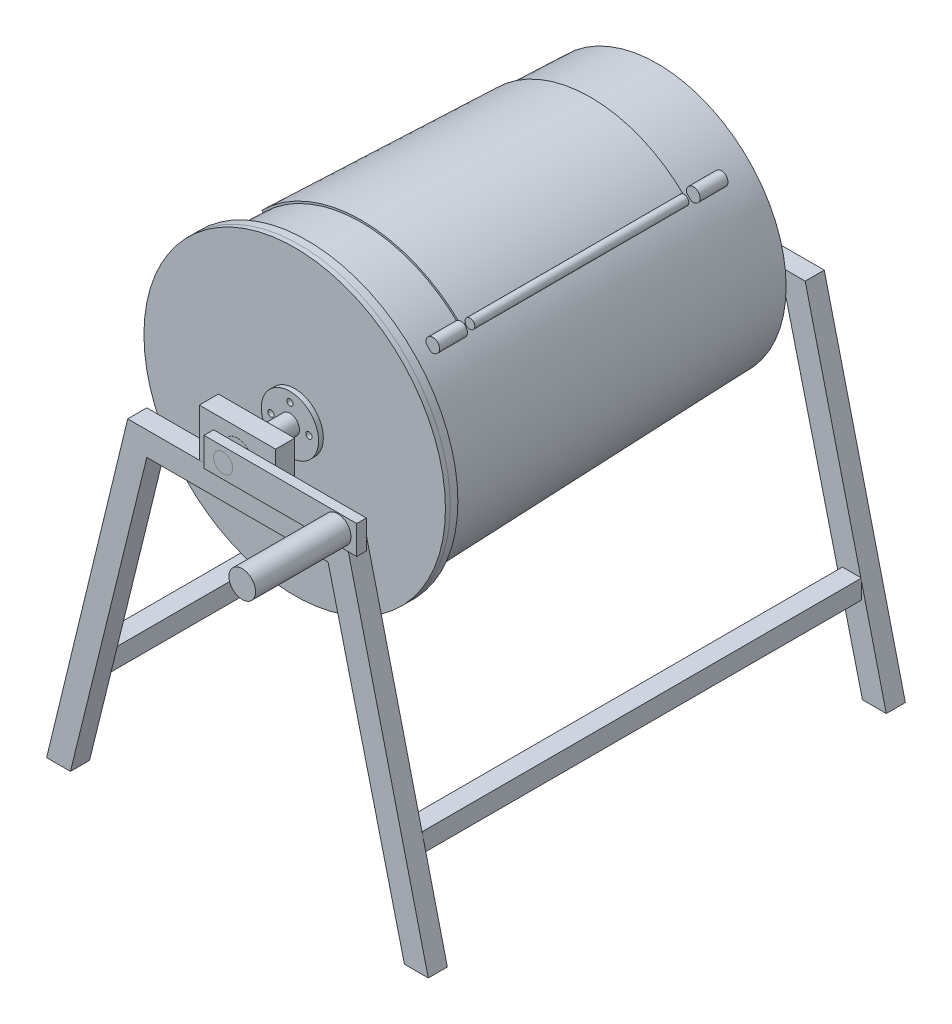
from build123d import *

# Parameters (mm, degrees)
RIGHT_SUPPORT_BLANK_START         = 230
RIGHT_SUPPORT_BLANK_DEPTH         = 20
HOLLOW_SUPPORT_2MM_T              = -2
F_20L_TAPERED_PAIL_BLANK_START    = -190
PAIL_BASE_PROFILE_R               = 135
F_20L_TAPERED_PAIL_BLANK_DEPTH    = 375
F_20L_TAPERED_PAIL_BLANK_DRAFT    = -1.99
F_20L_PAIL_PLASTIC_WALL_T         = -2
PAIL_REINFORCED_RIM_START         = 177
PAIL_RIM_PROFILE_R                = 158
PAIL_RIM_PROFILE_R_2              = 146
PAIL_REINFORCED_RIM_DEPTH         = 8
F_20L_PAIL_REMOVABLE_LID_START    = 185
ROUND_LID_PROFILE_R               = 158
F_20L_PAIL_REMOVABLE_LID_DEPTH    = 5
FRONT_BEARING_BLOCK_START         = 230
BEARING_BLOCK_PROFILE_W           = 80
BEARING_BLOCK_PROFILE_H           = 50
BEARING_BLOCK_PROFILE_R           = 15.1
FRONT_BEARING_BLOCK_DEPTH         = 20
FRONT_PLAIN_BUSH_START            = 230
PLAIN_BUSH_PROFILE_R              = 15
PLAIN_BUSH_PROFILE_R_2            = 10.2
FRONT_PLAIN_BUSH_DEPTH            = 20
LONGITUDINAL_BRACES_PROFILE_W     = 20
LONGITUDINAL_BRACES_PROFILE_H     = 20
LONGITUDINAL_BRACES_PROFILE_W_2   = 16
LONGITUDINAL_BRACES_PROFILE_H_2   = 16
FRAME_LONGITUDINAL_BRACES_DEPTH   = 230
FRAME_LONGITUDINAL_BRACES_2_DEPTH = 230
FRONT_CAGE_END_DISC_START         = 190
CAGE_END_DISC_PROFILE_R           = 30
CAGE_END_DISC_PROFILE_R_2         = 3.25
FRONT_CAGE_END_DISC_DEPTH         = 5
FRONT_ROTOR_STUB_START            = 190
ROTOR_STUB_PROFILE_R              = 10
FRONT_ROTOR_STUB_DEPTH            = 75
LOADING_OPENING_PROFILE_W         = 220
LOADING_OPENING_PROFILE_H         = 250
TOP_LOADING_OPENING_DEPTH         = 90
CRANK_ARM_START                   = 255
CRANK_ARM_PROFILE_W               = 160
CRANK_ARM_PROFILE_H               = 30
CRANK_ARM_PROFILE_R               = 10
CRANK_ARM_DEPTH                   = 10
ROTATING_CRANK_GRIP_START         = 265
CRANK_GRIP_PROFILE_R              = 14
ROTATING_CRANK_GRIP_DEPTH         = 100
CURVED_FOLDING_LID_ANGLE          = 90


with BuildPart() as part:
    # Support_Profile → Right_Support_Blank (new body)
    with BuildSketch(Plane.XY.offset(RIGHT_SUPPORT_BLANK_START)):
        Polygon((-200, 0), (-115, 350), (115, 350), (200, 0), (175, 0), (95, 325), (-95, 325), (-175, 0), align=None)
    extrude(amount=RIGHT_SUPPORT_BLANK_DEPTH)

    # Hollow_Support_2mm
    hollow_support_2mm_openings = [part.faces().sort_by_distance(p)[0] for p in [
        (187.5, 0, 240),
        (-187.5, 0, 240),
    ]]
    offset(amount=HOLLOW_SUPPORT_2MM_T, openings=hollow_support_2mm_openings, kind=Kind.INTERSECTION)


with BuildPart() as body_2:
    # Matching_Left_Support: mirrored copy
    add(part.part.mirror(Plane.XY))


with BuildPart() as body_3:
    # Pail_Base_Profile → 20L_Tapered_Pail_Blank (with draft: the straight prism first)
    with BuildSketch(Plane.XY.offset(F_20L_TAPERED_PAIL_BLANK_START)):
        with Locations((0, 375)):
            Circle(PAIL_BASE_PROFILE_R)
    extrude(amount=F_20L_TAPERED_PAIL_BLANK_DEPTH)
    # 20L_Tapered_Pail_Blank: the draft: its side faces are tilted about the plane it starts from
    f_20l_tapered_pail_blank_sides = [body_3.faces().sort_by_distance(p)[0] for p in [
        (-135, 375, -2.5),
    ]]
    draft(f_20l_tapered_pail_blank_sides, Plane.XY.offset(F_20L_TAPERED_PAIL_BLANK_START), F_20L_TAPERED_PAIL_BLANK_DRAFT)

    # 20L_Pail_Plastic_Wall
    f_20l_pail_plastic_wall_openings = [body_3.faces().sort_by_distance(p)[0] for p in [
        (0, 375, 185),
    ]]
    offset(amount=F_20L_PAIL_PLASTIC_WALL_T, openings=f_20l_pail_plastic_wall_openings, kind=Kind.INTERSECTION)

    # Pail_Rim_Profile → Pail_Reinforced_Rim (add)
    with BuildSketch(Plane.XY.offset(PAIL_REINFORCED_RIM_START)):
        with Locations((0, 375)):
            Circle(PAIL_RIM_PROFILE_R)
        with Locations((0, 375)):
            Circle(PAIL_RIM_PROFILE_R_2, mode=Mode.SUBTRACT)
    extrude(amount=PAIL_REINFORCED_RIM_DEPTH)

    # Loading_Opening_Profile → Top_Loading_Opening (cut, symmetric)
    with BuildSketch(Plane(origin=(0, 0, 0), x_dir=(0, 0, -1), z_dir=(1, 0, 0))):
        with Locations((0, 500)):
            Rectangle(LOADING_OPENING_PROFILE_W, LOADING_OPENING_PROFILE_H)
    extrude(amount=TOP_LOADING_OPENING_DEPTH, both=True, mode=Mode.SUBTRACT)

    # Drum_Hinge_Knuckle_Profile → Drum_Hinge_Knuckles (revolve)
    with BuildSketch(Plane(origin=(-187.431135244, 192.581293243, 0), x_dir=(0, 0, -1), z_dir=(0.6974595935863168, -0.7166241101961404, 0))):
        Polygon((155, 403.760680928), (125, 404.800680929), (125.242520982, 411.796478494), (155.242520982, 410.756478494), align=None)
        Polygon((-125, 413.467347597), (-155, 414.507347597), (-154.757479018, 421.503145162), (-124.757479018, 420.463145162), align=None)
    revolve(axis=Axis((101.540858921, 473.825374681, -170), (0.024828054735644017, 0.024164083679408414, 0.9993996521702309)))


with BuildPart() as body_4:
    # Round_Lid_Profile → 20L_Pail_Removable_Lid (new body)
    with BuildSketch(Plane.XY.offset(F_20L_PAIL_REMOVABLE_LID_START)):
        with Locations((0, 375)):
            Circle(ROUND_LID_PROFILE_R)
    extrude(amount=F_20L_PAIL_REMOVABLE_LID_DEPTH)


with BuildPart() as body_5:
    # Bearing_Block_Profile → Front_Bearing_Block (new body)
    with BuildSketch(Plane.XY.offset(FRONT_BEARING_BLOCK_START)):
        with Locations((0, 375)):
            Rectangle(BEARING_BLOCK_PROFILE_W, BEARING_BLOCK_PROFILE_H)
        with Locations((0, 375)):
            Circle(BEARING_BLOCK_PROFILE_R, mode=Mode.SUBTRACT)
    extrude(amount=FRONT_BEARING_BLOCK_DEPTH)


with BuildPart() as body_6:
    # Plain_Bush_Profile → Front_Plain_Bush (new body)
    with BuildSketch(Plane.XY.offset(FRONT_PLAIN_BUSH_START)):
        with Locations((0, 375)):
            Circle(PLAIN_BUSH_PROFILE_R)
        with Locations((0, 375)):
            Circle(PLAIN_BUSH_PROFILE_R_2, mode=Mode.SUBTRACT)
    extrude(amount=FRONT_PLAIN_BUSH_DEPTH)


with BuildPart() as body_7:
    # Rear_Bearing_Set: mirrored copy
    add(body_6.part.mirror(Plane.XY))


with BuildPart() as body_8:
    # Rear_Bearing_Set 2: mirrored copy
    add(body_5.part.mirror(Plane.XY))


with BuildPart() as body_9:
    # Longitudinal_Braces_Profile → Frame_Longitudinal_Braces (new, symmetric)
    with BuildSketch(Plane.XY):
        with Locations((-164, 100)):
            Rectangle(LONGITUDINAL_BRACES_PROFILE_W, LONGITUDINAL_BRACES_PROFILE_H)
        with Locations((-164, 100)):
            Rectangle(LONGITUDINAL_BRACES_PROFILE_W_2, LONGITUDINAL_BRACES_PROFILE_H_2, mode=Mode.SUBTRACT)
    extrude(amount=FRAME_LONGITUDINAL_BRACES_DEPTH, both=True)


with BuildPart() as body_10:
    # Longitudinal_Braces_Profile → Frame_Longitudinal_Braces 2 (new, symmetric)
    with BuildSketch(Plane.XY):
        with Locations((164, 100)):
            Rectangle(LONGITUDINAL_BRACES_PROFILE_W, LONGITUDINAL_BRACES_PROFILE_H)
        with Locations((164, 100)):
            Rectangle(LONGITUDINAL_BRACES_PROFILE_W_2, LONGITUDINAL_BRACES_PROFILE_H_2, mode=Mode.SUBTRACT)
    extrude(amount=FRAME_LONGITUDINAL_BRACES_2_DEPTH, both=True)


with BuildPart() as body_11:
    # Cage_End_Disc_Profile → Front_Cage_End_Disc (new body)
    with BuildSketch(Plane.XY.offset(FRONT_CAGE_END_DISC_START)):
        with Locations((0, 375)):
            Circle(CAGE_END_DISC_PROFILE_R)
        with Locations((20, 375)):
            Circle(CAGE_END_DISC_PROFILE_R_2, mode=Mode.SUBTRACT)
        with Locations((0, 395)):
            Circle(CAGE_END_DISC_PROFILE_R_2, mode=Mode.SUBTRACT)
        with Locations((-20, 375)):
            Circle(CAGE_END_DISC_PROFILE_R_2, mode=Mode.SUBTRACT)
        with Locations((0, 355)):
            Circle(CAGE_END_DISC_PROFILE_R_2, mode=Mode.SUBTRACT)
    extrude(amount=FRONT_CAGE_END_DISC_DEPTH)

    # Rotor_Stub_Profile → Front_Rotor_Stub (add)
    with BuildSketch(Plane.XY.offset(FRONT_ROTOR_STUB_START)):
        with Locations((0, 375)):
            Circle(ROTOR_STUB_PROFILE_R)
    extrude(amount=FRONT_ROTOR_STUB_DEPTH)


with BuildPart() as body_12:
    # Rear_Cage_End_And_Stub: mirrored copy
    add(body_11.part.mirror(Plane.XY))


with BuildPart() as body_13:
    # Crank_Arm_Profile → Crank_Arm (new body)
    with BuildSketch(Plane.XY.offset(CRANK_ARM_START)):
        with Locations((60, 375)):
            Rectangle(CRANK_ARM_PROFILE_W, CRANK_ARM_PROFILE_H)
        with Locations((0, 375)):
            Circle(CRANK_ARM_PROFILE_R, mode=Mode.SUBTRACT)
    extrude(amount=CRANK_ARM_DEPTH)


with BuildPart() as body_14:
    # Crank_Grip_Profile → Rotating_Crank_Grip (new body)
    with BuildSketch(Plane.XY.offset(ROTATING_CRANK_GRIP_START)):
        with Locations((120, 375)):
            Circle(CRANK_GRIP_PROFILE_R)
    extrude(amount=ROTATING_CRANK_GRIP_DEPTH)


with BuildPart() as body_15:
    # Folding_Lid_Profile → Curved_Folding_Lid (revolve, symmetric)
    with BuildSketch(Plane(origin=(0, 0, 0), x_dir=(0, 0, -1), z_dir=(1, 0, 0))) as curved_folding_lid_sk:
        Polygon((120, 512.432221736), (-120, 520.771267686), (-120, 522.771267686), (120, 514.432221736), align=None)
    revolve(axis=Axis((0, 375, -200), (0, 0, 1)), revolution_arc=CURVED_FOLDING_LID_ANGLE / 2)
    revolve(curved_folding_lid_sk.sketch, axis=Axis((0, 375, -200), (0, 0, -1)), revolution_arc=CURVED_FOLDING_LID_ANGLE / 2)

    # Lid_Hinge_Barrel_Profile → Lid_Hinge_Barrel (revolve)
    with BuildSketch(Plane(origin=(-187.431135244, 192.581293243, 0), x_dir=(0, 0, -1), z_dir=(0.6974595935863168, -0.7166241101961404, 0))):
        Polygon((115, 405.147347595), (-115, 413.12068093), (-114.826770727, 418.117679191), (115.173229273, 410.144345856), align=None)
    revolve(axis=Axis((101.540858921, 473.825374681, -170), (0.024828054735644017, 0.024164083679408414, 0.9993996521702309)))


solid = Compound([part.part, body_2.part, body_3.part, body_4.part, body_5.part, body_6.part, body_7.part, body_8.part, body_9.part, body_10.part, body_11.part, body_12.part, body_13.part, body_14.part, body_15.part])
